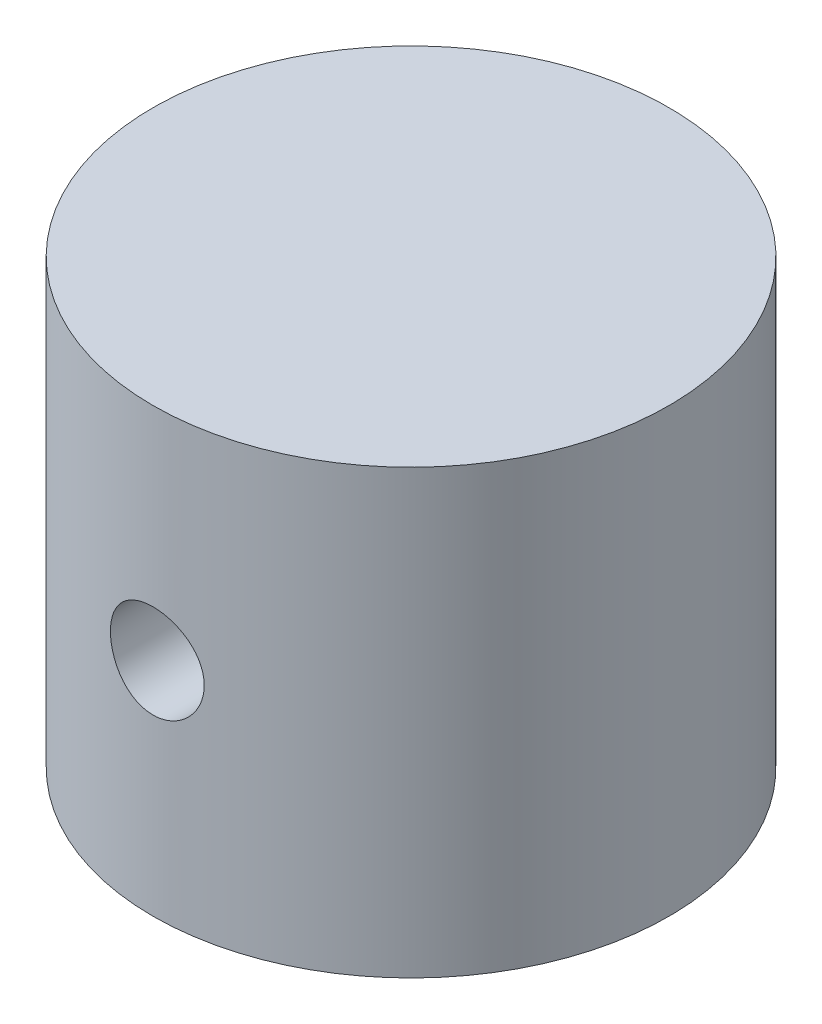
from build123d import *

# Parameters (mm, degrees)
SKETCH1_R                  = 11.1125
BOSS_EXTRUDE1_DEPTH        = 19.05
F_10_32_TAPPED_HOLE1_D     = 4.0386
F_10_32_TAPPED_HOLE1_DEPTH = 11.176
F_10_32_TAPPED_HOLE1_TIP   = 1.213317848


with BuildPart() as part:
    # Sketch1 → Boss-Extrude1 (new body)
    with BuildSketch(Plane(origin=(0, 0, 0), x_dir=(1, 0, 0), z_dir=(0, 1, 0))):
        Circle(SKETCH1_R)
    extrude(amount=BOSS_EXTRUDE1_DEPTH)

    # #10-32 Tapped Hole1
    with Locations(Plane(origin=(0, 9.525, 11.1125), x_dir=(0, 1, 0), z_dir=(0, 0, 1))):
        with Locations((0, 0)):
            Hole(F_10_32_TAPPED_HOLE1_D / 2, depth=F_10_32_TAPPED_HOLE1_DEPTH)
            with Locations((0, 0, -(F_10_32_TAPPED_HOLE1_DEPTH + F_10_32_TAPPED_HOLE1_TIP / 2))):  # 118° drill point
                Cone(0, F_10_32_TAPPED_HOLE1_D / 2, F_10_32_TAPPED_HOLE1_TIP, mode=Mode.SUBTRACT)


solid = part.part
